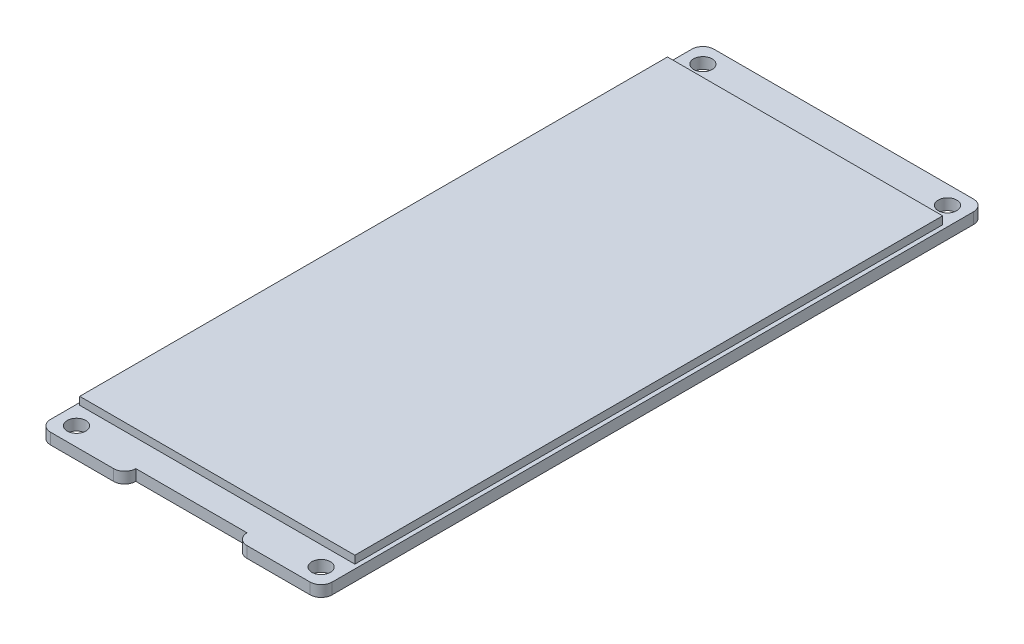
from build123d import *

# Parameters (mm, degrees)
SKETCH1_R           = 1.25
BOSS_EXTRUDE1_DEPTH = 1.5
SKETCH2_W           = 37.118680969
SKETCH2_H           = 79.295382989
BOSS_EXTRUDE2_DEPTH = 1.05


with BuildPart() as part:
    # Sketch1 → Boss-Extrude1 (new body)
    with BuildSketch(Plane(origin=(0, 0, 0), x_dir=(1, 0, 0), z_dir=(0, 1, 0))):
        with BuildLine():
            Line((1.5, 0), (10, 0))
            ThreePointArc((10, 0), (11.060660172, 0.439339828), (11.5, 1.5))
            Line((11.5, 1.5), (26.5, 1.5))
            ThreePointArc((26.5, 1.5), (26.939339828, 0.439339828), (28, 0))
            Line((28, 0), (36.5, 0))
            ThreePointArc((36.5, 0), (37.560660172, 0.439339828), (38, 1.5))
            Line((38, 1.5), (38, 88))
            ThreePointArc((38, 88), (37.560660172, 89.060660172), (36.5, 89.5))
            Line((36.5, 89.5), (1.5, 89.5))
            ThreePointArc((1.5, 89.5), (0.439339828, 89.060660172), (0, 88))
            Line((0, 88), (0, 1.5))
            ThreePointArc((0, 1.5), (0.439339828, 0.439339828), (1.5, 0))
        make_face()
        with Locations((2.5, 2.5)):
            Circle(SKETCH1_R, mode=Mode.SUBTRACT)
        with Locations((35.5, 2.5)):
            Circle(SKETCH1_R, mode=Mode.SUBTRACT)
        with Locations((35.5, 87)):
            Circle(SKETCH1_R, mode=Mode.SUBTRACT)
        with Locations((2.5, 87)):
            Circle(SKETCH1_R, mode=Mode.SUBTRACT)
    extrude(amount=BOSS_EXTRUDE1_DEPTH)

    # Sketch2 → Boss-Extrude2 (add)
    with BuildSketch(Plane(origin=(0, 1.5, 0), x_dir=(1, 0, 0), z_dir=(0, 1, 0))):
        with Locations((18.880991901, 44.755610098)):
            Rectangle(SKETCH2_W, SKETCH2_H)
    extrude(amount=BOSS_EXTRUDE2_DEPTH)


solid = part.part
